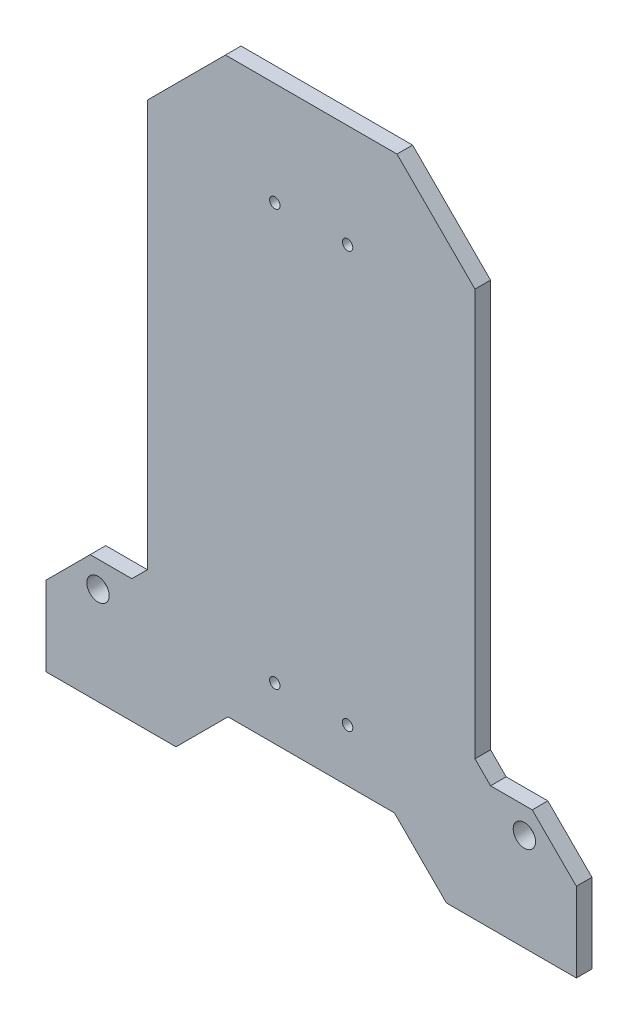
from build123d import *

# Parameters (mm, degrees)
EXTRUDE_1_DEPTH     = 3
SKETCH_2_R          = 2.15
CUT_EXTRUDE_1_DEPTH = 3
SKETCH_3_R          = 1
CUT_EXTRUDE_2_DEPTH = 70
CUT_EXTRUDE1_DEPTH  = 10
CHAMFER1_SIZE       = 15
CHAMFER2_SIZE       = 3
CUT_EXTRUDE2_DEPTH  = 10


with BuildPart() as part:
    # 草图1 → 凸台-拉伸1 (new body)
    with BuildSketch(Plane.XY):
        Polygon((-51.0025, -68.891882816), (51.0025, -68.891882816), (51.0025, 35.266689181), (40.10963441, 51.108117184), (-37.096440595, 51.108117184), (-51.0025, 41.546047656), align=None)
    extrude(amount=-EXTRUDE_1_DEPTH)

    # 草图2 → 切除-拉伸1 (cut)
    with BuildSketch(Plane.XY):
        with Locations((-41.0025, 9.872461287)):
            Circle(SKETCH_2_R)
        with Locations((-41.0025, -50.127538712)):
            Circle(SKETCH_2_R)
        with Locations((41.0025, 9.872461287)):
            Circle(SKETCH_2_R)
        with Locations((41.0025, -50.127538712)):
            Circle(SKETCH_2_R)
    extrude(amount=-CUT_EXTRUDE_1_DEPTH, mode=Mode.SUBTRACT)

    # 草图3 → 切除-拉伸2 (cut)
    with BuildSketch(Plane(origin=(0, 0, -3), x_dir=(-1, 0, 0), z_dir=(0, 0, -1))):
        with Locations((-7.000166, 31.25)):
            Circle(SKETCH_3_R)
        with Locations((6.999834, 31.25)):
            Circle(SKETCH_3_R)
        with Locations((-7.000166, -48.75)):
            Circle(SKETCH_3_R)
        with Locations((6.999834, -48.75)):
            Circle(SKETCH_3_R)
    extrude(amount=-CUT_EXTRUDE_2_DEPTH, mode=Mode.SUBTRACT)

    # Sketch1 → Cut-Extrude1 (cut)
    with BuildSketch(Plane.XY):
        Polygon((51.0025, -53.612820087), (42.517218626, -45.127538713), (31.499996481, -45.127538713), (31.499964702, 63.629107338), (51.0025, 63.629107338), align=None)
        Polygon((-31.499999356, -45.127538713), (-42.517218626, -45.127538713), (-51.0025, -53.612820087), (-51.0025, 54.95635915), (-31.499965771, 54.95635915), align=None)
    extrude(amount=-CUT_EXTRUDE1_DEPTH, mode=Mode.SUBTRACT)

    # Chamfer1
    chamfer1_edges = [part.edges().sort_by_distance(p)[0] for p in [
        (-31.499967062, 51.108117184, -1.5),
        (31.499968361, 51.108117184, -1.5),
    ]]
    chamfer(chamfer1_edges, length=CHAMFER1_SIZE)

    # Chamfer2
    chamfer2_edges = [part.edges().sort_by_distance(p)[0] for p in [
        (31.499996481, -45.127538713, -1.5),
        (-31.499999356, -45.127538713, -1.5),
    ]]
    chamfer(chamfer2_edges, length=CHAMFER2_SIZE)

    # Sketch2 → Cut-Extrude2 (cut)
    with BuildSketch(Plane.XY):
        Polygon((-26.0025, -68.891882816), (-16.0025, -58.891882816), (16.0025, -58.891882816), (26.0025, -68.891882816), align=None)
    extrude(amount=-CUT_EXTRUDE2_DEPTH, mode=Mode.SUBTRACT)


solid = part.part
